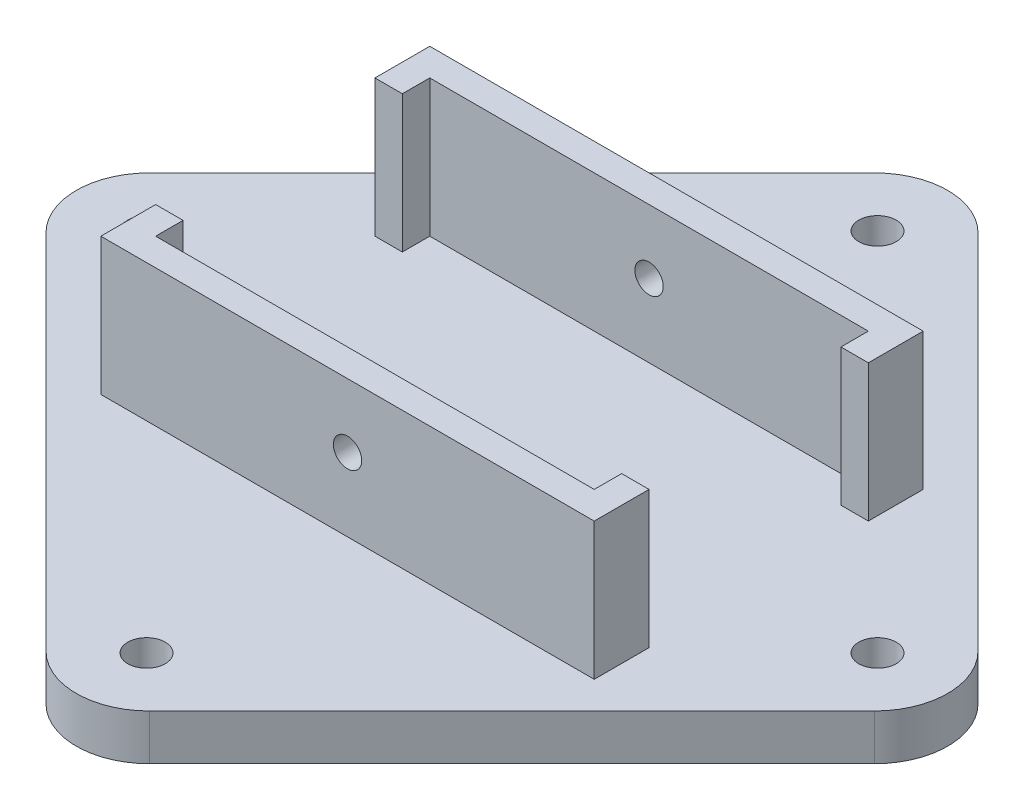
from build123d import *

# Parameters (mm, degrees)
SKETCH_1_R               = 2.05
EXTRUDE_1_DEPTH          = 5
EXTRUDE_2_DEPTH          = 15
CUT_EXTRUDE_1_DEPTH      = 84.598273237
CUT_EXTRUDE_1_DEPTH_BACK = 84.598273237
SKETCH_3_R               = 1.55


with BuildPart() as part:
    # 草图1 → 凸台-拉伸1 (new body)
    with BuildSketch(Plane(origin=(0, 0, 0), x_dir=(1, 0, 0), z_dir=(0, 1, 0))):
        with BuildLine():
            Line((-5.656854249, 45.343145751), (-45.343145751, 5.656854249))
            ThreePointArc((-45.343145751, 5.656854249), (-47.686291501, 0), (-45.343145751, -5.656854249))
            Line((-45.343145751, -5.656854249), (-5.656854249, -45.343145751))
            ThreePointArc((-5.656854249, -45.343145751), (0, -47.686291501), (5.656854249, -45.343145751))
            Line((5.656854249, -45.343145751), (45.343145751, -5.656854249))
            ThreePointArc((45.343145751, -5.656854249), (47.686291501, 0), (45.343145751, 5.656854249))
            Line((45.343145751, 5.656854249), (5.656854249, 45.343145751))
            ThreePointArc((5.656854249, 45.343145751), (0, 47.686291501), (-5.656854249, 45.343145751))
        make_face()
        with Locations((0, 40)):
            Circle(SKETCH_1_R, mode=Mode.SUBTRACT)
        with Locations((40, 0)):
            Circle(SKETCH_1_R, mode=Mode.SUBTRACT)
        with Locations((0, -40)):
            Circle(SKETCH_1_R, mode=Mode.SUBTRACT)
        with Locations((-40, 0)):
            Circle(SKETCH_1_R, mode=Mode.SUBTRACT)
    extrude(amount=EXTRUDE_1_DEPTH)

    # 草图2 → 凸台-拉伸2 (add)
    with BuildSketch(Plane(origin=(0, 5, 0), x_dir=(1, 0, 0), z_dir=(0, 1, 0))):
        Polygon((-27, 12), (-24, 12), (-24, 15), (24, 15), (24, 12), (27, 12), (27, 18), (-27, 18), align=None)
        Polygon((27, -18), (-27, -18), (-27, -12), (-24, -12), (-24, -15), (24, -15), (24, -12), (27, -12), align=None)
    extrude(amount=EXTRUDE_2_DEPTH)

    # 草图3 → 切除-拉伸1 (cut, two sides: drawn at the far end of the back side and taken through both)
    with BuildSketch(Plane.XY.offset(18).offset(-CUT_EXTRUDE_1_DEPTH_BACK)):
        with Locations((0, 13)):
            Circle(SKETCH_3_R)
    extrude(amount=CUT_EXTRUDE_1_DEPTH + CUT_EXTRUDE_1_DEPTH_BACK, mode=Mode.SUBTRACT)


solid = part.part
